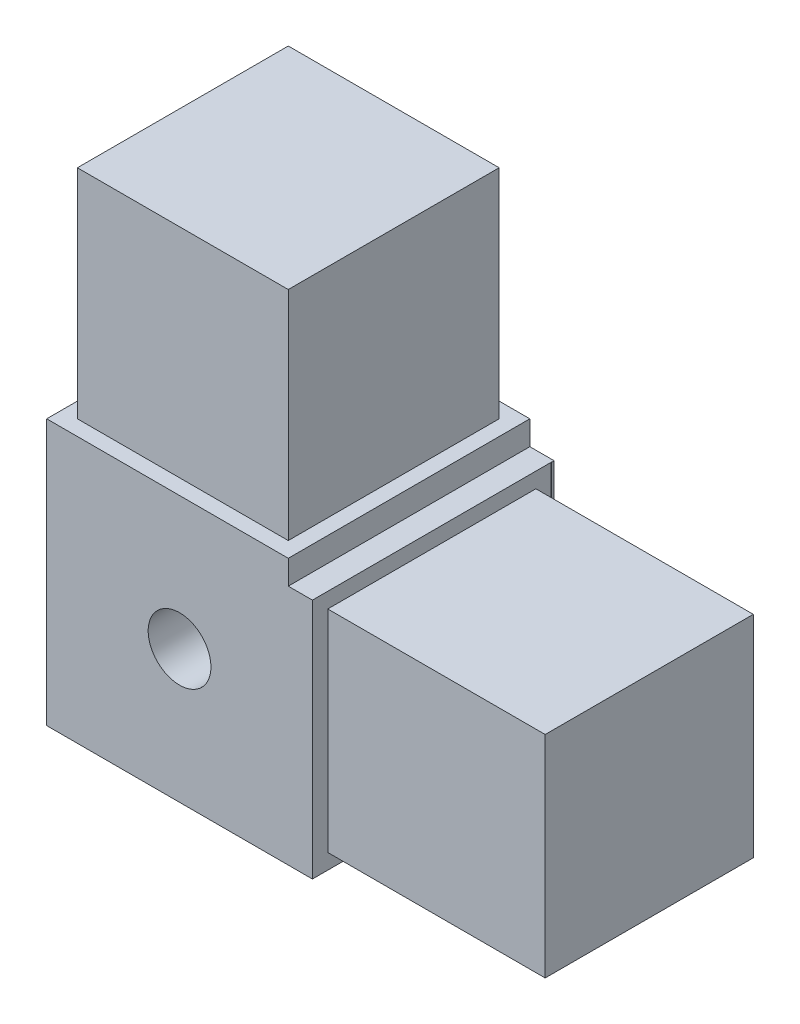
from build123d import *

# Parameters (mm, degrees)
SKETCH1_W           = 50.8
SKETCH1_H           = 50.8
BOSS_EXTRUDE1_DEPTH = 12.7
SKETCH2_W           = 25.4
SKETCH2_H           = 25.4
CUT_EXTRUDE1_DEPTH  = 44.994090512
SKETCH3_W           = 25.109814144
SKETCH3_H           = 25.4
SKETCH3_W_2         = 21.884014144
SKETCH3_H_2         = 22.1742
CUT_EXTRUDE2_DEPTH  = 22.86
SKETCH5_W           = 25.4
SKETCH5_H           = 25.4
SKETCH5_W_2         = 22.1742
SKETCH5_H_2         = 22.1742
CUT_EXTRUDE4_DEPTH  = 22.86
CUT_EXTRUDE5_REACH  = 45.994
SKETCH6_W           = 22.835323581
SKETCH6_H           = 25.4
SKETCH7_R           = 3.3
CUT_EXTRUDE6_DEPTH  = 44.994090512


with BuildPart() as part:
    # Sketch1 → Boss-Extrude1 (new, symmetric)
    with BuildSketch(Plane.XY):
        Rectangle(SKETCH1_W, SKETCH1_H)
    extrude(amount=BOSS_EXTRUDE1_DEPTH, both=True)

    # Sketch2 → Cut-Extrude1 (cut, through all)
    with BuildSketch(Plane.XY.offset(12.7)):
        with Locations((12.7, 12.7)):
            Rectangle(SKETCH2_W, SKETCH2_H)
    extrude(amount=-CUT_EXTRUDE1_DEPTH, mode=Mode.SUBTRACT)

    # Sketch3 → Cut-Extrude2 (cut)
    with BuildSketch(Plane(origin=(25.4, 0, 0), x_dir=(0, 0, -1), z_dir=(1, 0, 0))):
        with Locations((-0.145092928, -12.7)):
            Rectangle(SKETCH3_W, SKETCH3_H)
        with Locations((-0.145092928, -12.7)):
            Rectangle(SKETCH3_W_2, SKETCH3_H_2, mode=Mode.SUBTRACT)
    extrude(amount=-CUT_EXTRUDE2_DEPTH, mode=Mode.SUBTRACT)

    # Sketch5 → Cut-Extrude4 (cut)
    with BuildSketch(Plane(origin=(0, 25.4, 0), x_dir=(1, 0, 0), z_dir=(0, 1, 0))):
        with Locations((-12.7, 0)):
            Rectangle(SKETCH5_W, SKETCH5_H)
        with Locations((-12.7, 0)):
            Rectangle(SKETCH5_W_2, SKETCH5_H_2, mode=Mode.SUBTRACT)
    extrude(amount=-CUT_EXTRUDE4_DEPTH, mode=Mode.SUBTRACT)

    # Sketch6 → Cut-Extrude5 (cut, up to next)
    with BuildSketch(Plane(origin=(0, 0, -12.7), x_dir=(-1, 0, 0), z_dir=(0, 0, -1)), mode=Mode.PRIVATE) as cut_extrude5_sk1:
        with Locations((-13.98233821, -12.7)):
            Rectangle(SKETCH6_W, SKETCH6_H)
    cut_extrude5_tool1 = extrude(cut_extrude5_sk1.sketch, amount=-CUT_EXTRUDE5_REACH, mode=Mode.PRIVATE) & part.part
    add(cut_extrude5_tool1.solids().sort_by_distance((13.982338, -12.7, -12.7))[0], mode=Mode.SUBTRACT)

    # Sketch7 → Cut-Extrude6 (cut, through all)
    with BuildSketch(Plane.XY.offset(12.7)):
        with Locations((-11.43, -11.43)):
            Circle(SKETCH7_R)
    extrude(amount=-CUT_EXTRUDE6_DEPTH, mode=Mode.SUBTRACT)


solid = part.part
